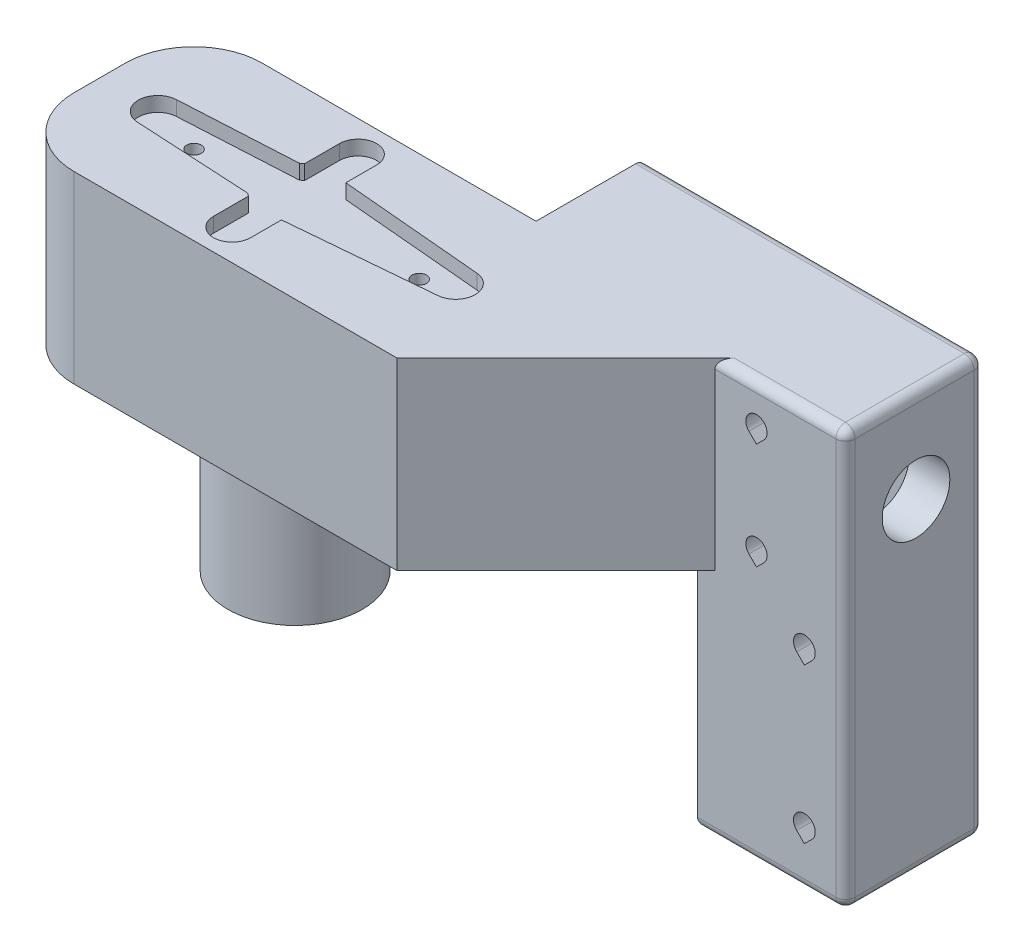
from build123d import *

# Parameters (mm, degrees)
RESSALTO_EXTRUS_O1_DEPTH = 1.4
ESBO_O2_R                = 3.45
RESSALTO_EXTRUS_O2_DEPTH = 2.4
FURO1_D                  = 1.2
PADR_O_LINEAR1_COUNT     = 6
PADR_O_LINEAR1_PITCH     = 2
RESSALTO_EXTRUS_O3_DEPTH = 1.4
FURO2_D                  = 1.2
PADR_O_LINEAR2_COUNT     = 7
PADR_O_LINEAR2_PITCH     = 2
RESSALTO_EXTRUS_O4_DEPTH = 1.4
FURO3_D                  = 1.2
PADR_O_LINEAR3_COUNT     = 2
PADR_O_LINEAR3_PITCH     = 2
PADR_OCIRCULAR1_COUNT    = 2
PADR_OCIRCULAR1_COPY_1_D = 1.2
FURO4_D                  = 4.95
FURO4_DEPTH              = 2
FURO5_D                  = 4.6
FURO5_DEPTH              = 1
FURO6_D                  = 2.1
RESSALTO_EXTRUS_O5_START = -2
RESSALTO_EXTRUS_O5_DEPTH = 2
PADR_OCIRCULAR2_COUNT    = 60
BOSS_EXTRUDE1_DEPTH      = 4
FILLET1_R                = 7
BOSS_EXTRUDE2_START      = -2.5
SKETCH2_R                = 1.7
BOSS_EXTRUDE2_DEPTH      = 2.5
SCALE1_SCALE             = 1.01
SKETCH3_R                = 6.95
BOSS_EXTRUDE3_DEPTH      = 30
SKETCH4_R                = 0.75
CUT_EXTRUDE1_DEPTH       = 2.525
BOSS_EXTRUDE4_OUTLINE_R  = 1.717
BOSS_EXTRUDE4_DEPTH      = 2.525
SKETCH6_R                = 0.75
BOSS_EXTRUDE5_DEPTH      = 15
SKETCH7_W                = 3
SKETCH7_H                = 19.04
BOSS_EXTRUDE6_DEPTH      = 30
SKETCH8_W                = 35
SKETCH8_H                = 19.04
BOSS_EXTRUDE7_DEPTH      = 11.29409
SKETCH9_R                = 3.498615
CUT_EXTRUDE2_DEPTH       = 35
SKETCH10_W               = 9.58817
SKETCH10_H               = 16.58818
CUT_EXTRUDE3_DEPTH       = 30.79409
CHAMFER2_SIZE            = 16.5
CUT_EXTRUDE4_DEPTH       = 3
BOSS_EXTRUDE8_DEPTH      = 24
BOSS_EXTRUDE9_DEPTH      = 11.29409
SKETCH17_W               = 13.8
SKETCH17_H               = 2
BOSS_EXTRUDE10_DEPTH     = 22
FILLET2_R                = 1
CUT_EXTRUDE8_DEPTH       = 10


# Read off the part's stored shape, not the designer's step: Boss-Extrude4
with BuildPart() as part:
    # Esboço1 → Ressalto-extrusão1 (new body)
    with BuildSketch(Plane(origin=(0, 0, 0), x_dir=(1, 0, 0), z_dir=(0, 1, 0))):
        with BuildLine():
            Line((-14.159121967, 1.99702088), (-2.209072203, 2.65))
            ThreePointArc((-2.209072203, 2.65), (3.45, 0), (-2.209072203, -2.65))
            Line((-2.209072203, -2.65), (-14.159121967, -1.99702088))
            ThreePointArc((-14.159121967, -1.99702088), (-16.05, 0), (-14.159121967, 1.99702088))
        make_face()
    extrude(amount=-RESSALTO_EXTRUS_O1_DEPTH)

    # Esboço2 → Ressalto-extrusão2 (add)
    with BuildSketch(Plane.XZ.offset(1.4)):
        with Locations(Location((0, 0, 0), (0, 0, 90))):
            Circle(ESBO_O2_R)
    extrude(amount=RESSALTO_EXTRUS_O2_DEPTH)

    # Furo1 (through all)
    with Locations(Plane(origin=(0, 0, 0), x_dir=(1, 0, 0), z_dir=(0, 1, 0))):
        with Locations((-14.45, 0)):
            furo1 = Hole(FURO1_D / 2)

    # Padrão linear1: Furo1 ×6
    with Locations(*[(i * PADR_O_LINEAR1_PITCH, 0, 0) for i in range(1, PADR_O_LINEAR1_COUNT)]):
        add(furo1, mode=Mode.SUBTRACT)

    # Esboço12 → Ressalto-extrusão3 (add)
    with BuildSketch(Plane(origin=(0, 0, 0), x_dir=(1, 0, 0), z_dir=(0, 1, 0))):
        with BuildLine():
            Line((0.304103343, 3.436571134), (16.626291793, 1.99221515))
            ThreePointArc((16.626291793, 1.99221515), (18.45, 0), (16.626291793, -1.99221515))
            Line((16.626291793, -1.99221515), (0.304103343, -3.436571134))
            ThreePointArc((0.304103343, -3.436571134), (3.45, 0), (0.304103343, 3.436571134))
        make_face()
    extrude(amount=-RESSALTO_EXTRUS_O3_DEPTH)

    # Furo2 (through all)
    with Locations(Plane(origin=(0, 0, 0), x_dir=(1, 0, 0), z_dir=(0, 1, 0))):
        with Locations((16.85, 0)):
            furo2 = Hole(FURO2_D / 2)

    # Padrão linear2: Furo2 ×7
    with Locations(*[(-i * PADR_O_LINEAR2_PITCH, 0, 0) for i in range(1, PADR_O_LINEAR2_COUNT)]):
        add(furo2, mode=Mode.SUBTRACT)

    # Esboço16 → Ressalto-extrusão4 (add)
    with BuildSketch(Plane(origin=(0, 0, 0), x_dir=(1, 0, 0), z_dir=(0, 1, 0))):
        with BuildLine():
            Line((-1.9, -6.45), (-1.9, 6.45))
            ThreePointArc((-1.9, 6.45), (0, 8.35), (1.9, 6.45))
            Line((1.9, 6.45), (1.9, -6.45))
            ThreePointArc((1.9, -6.45), (0, -8.35), (-1.9, -6.45))
        make_face()
    extrude(amount=-RESSALTO_EXTRUS_O4_DEPTH)

    # Furo3 (through all)
    with Locations(Plane(origin=(0, 0, 0), x_dir=(1, 0, 0), z_dir=(0, 1, 0))):
        with Locations((0, -6.45)):
            furo3 = Hole(FURO3_D / 2)

    # Padrão linear3: Furo3 ×2
    with Locations(*[(0, 0, -i * PADR_O_LINEAR3_PITCH) for i in range(1, PADR_O_LINEAR3_COUNT)]):
        add(furo3, mode=Mode.SUBTRACT)

    # PadrãoCircular1: Furo3 ×2 about axis
    padr_ocircular1_axis = Axis((0, 0, 0), (0, 1, 0))
    for i in range(1, PADR_OCIRCULAR1_COUNT):
        add(furo3.rotate(padr_ocircular1_axis, i * 360 / PADR_OCIRCULAR1_COUNT), mode=Mode.SUBTRACT)

    # PadrãoCircular1 copy 1 (through all)
    with Locations(Plane(origin=(0, 0, 2), x_dir=(-1, 0, 0), z_dir=(0, 1, 0))):
        with Locations((0, -6.45)):
            Hole(PADR_OCIRCULAR1_COPY_1_D / 2)

    # Furo4
    with Locations(Plane(origin=(0, -3.8, 0), x_dir=(-1, 0, 0), z_dir=(0, -1, 0))):
        with Locations((0, 0)):
            Hole(FURO4_D / 2, depth=FURO4_DEPTH)

    # Furo5
    with Locations(Plane(origin=(0, 0, 0), x_dir=(1, 0, 0), z_dir=(0, 1, 0))):
        with Locations((0, 0)):
            Hole(FURO5_D / 2, depth=FURO5_DEPTH)

    # Furo6 (through all)
    with Locations(Plane(origin=(0, 0, 0), x_dir=(1, 0, 0), z_dir=(0, 1, 0))):
        with Locations((0, 0)):
            Hole(FURO6_D / 2)

    # Esboço11 → Ressalto-extrusão5 (add)
    with BuildSketch(Plane.XZ.offset(3.8).offset(RESSALTO_EXTRUS_O5_START)):
        with BuildLine():
            Line((-0.098056786, 2.473056786), (0, 2.375))
            Line((0, 2.375), (0.098056786, 2.473056786))
            ThreePointArc((0.098056786, 2.473056786), (0, 2.475), (-0.098056786, 2.473056786))
        make_face()
    ressalto_extrus_o5 = extrude(amount=RESSALTO_EXTRUS_O5_DEPTH)

    # PadrãoCircular2: Ressalto-extrusão5 ×60 about axis
    padr_ocircular2_axis = Axis((0, 0, 0), (0, 1, 0))
    for i in range(1, PADR_OCIRCULAR2_COUNT):
        add(ressalto_extrus_o5.rotate(padr_ocircular2_axis, i * 360 / PADR_OCIRCULAR2_COUNT))


with BuildPart() as body_2:
    # Sketch1 → Boss-Extrude1 (new body)
    with BuildSketch(Plane(origin=(0, 0, 0), x_dir=(1, 0, 0), z_dir=(0, 1, 0))):
        with BuildLine():
            Line((20, 9.624635015), (-20, 9.624635015))
            Line((-20, 9.624635015), (-5.170447338, 2.488183425))
            Line((-5.170447338, 2.488183425), (-2.209072203, 2.65))
            ThreePointArc((-2.209072203, 2.65), (-2.057742862, 2.769150468), (-1.9, 2.87967012))
            Line((-1.9, 2.87967012), (-1.9, 6.45))
            ThreePointArc((-1.9, 6.45), (0, 8.35), (1.9, 6.45))
            Line((1.9, 6.45), (1.9, 3.295349698))
            Line((1.9, 3.295349698), (6.079247067, 2.92552671))
            Line((6.079247067, 2.92552671), (20, 9.624635015))
        make_face()
        with BuildLine():
            Line((-5.170447338, 2.488183425), (-20, 9.624635015))
            Line((-20, 9.624635015), (-20, -9.624635015))
            Line((-20, -9.624635015), (-5.170447338, -2.488183425))
            Line((-5.170447338, -2.488183425), (-14.159121967, -1.99702088))
            ThreePointArc((-14.159121967, -1.99702088), (-16.05, 0), (-14.159121967, 1.99702088))
            Line((-14.159121967, 1.99702088), (-5.170447338, 2.488183425))
        make_face()
        with BuildLine():
            Line((-5.170447338, -2.488183425), (-20, -9.624635015))
            Line((-20, -9.624635015), (20, -9.624635015))
            Line((20, -9.624635015), (6.079247067, -2.92552671))
            Line((6.079247067, -2.92552671), (1.9, -3.295349698))
            Line((1.9, -3.295349698), (1.9, -6.45))
            ThreePointArc((1.9, -6.45), (0, -8.35), (-1.9, -6.45))
            Line((-1.9, -6.45), (-1.9, -2.87967012))
            ThreePointArc((-1.9, -2.87967012), (-2.057742862, -2.769150468), (-2.209072203, -2.65))
            Line((-2.209072203, -2.65), (-5.170447338, -2.488183425))
        make_face()
        with BuildLine():
            Line((20, -9.624635015), (20, 9.624635015))
            Line((20, 9.624635015), (6.079247067, 2.92552671))
            Line((6.079247067, 2.92552671), (16.626291793, 1.99221515))
            ThreePointArc((16.626291793, 1.99221515), (18.45, 0), (16.626291793, -1.99221515))
            Line((16.626291793, -1.99221515), (6.079247067, -2.92552671))
            Line((6.079247067, -2.92552671), (20, -9.624635015))
        make_face()
    extrude(amount=BOSS_EXTRUDE1_DEPTH)

    # Fillet1
    fillet1_edges = [body_2.edges().sort_by_distance(p)[0] for p in [
        (-20, 2, 9.624635015),
        (-20, 2, -9.624635015),
    ]]
    fillet(fillet1_edges, radius=FILLET1_R)

    # Sketch2 → Boss-Extrude2 (add)
    with BuildSketch(Plane.XZ.offset(BOSS_EXTRUDE2_START)):
        with BuildLine():
            Line((-1.9, 2.87967012), (-1.9, 6.45))
            ThreePointArc((-1.9, 6.45), (0, 8.35), (1.9, 6.45))
            Line((1.9, 6.45), (1.9, 3.295349698))
            Line((1.9, 3.295349698), (16.626291793, 1.99221515))
            ThreePointArc((16.626291793, 1.99221515), (18.45, 0), (16.626291793, -1.99221515))
            Line((16.626291793, -1.99221515), (1.9, -3.295349698))
            Line((1.9, -3.295349698), (1.9, -6.45))
            ThreePointArc((1.9, -6.45), (0, -8.35), (-1.9, -6.45))
            Line((-1.9, -6.45), (-1.9, -2.87967012))
            ThreePointArc((-1.9, -2.87967012), (-2.057742862, -2.769150468), (-2.209072203, -2.65))
            Line((-2.209072203, -2.65), (-14.159121967, -1.99702088))
            ThreePointArc((-14.159121967, -1.99702088), (-16.05, 0), (-14.159121967, 1.99702088))
            Line((-14.159121967, 1.99702088), (-2.209072203, 2.65))
            ThreePointArc((-2.209072203, 2.65), (-2.057742862, 2.769150468), (-1.9, 2.87967012))
        make_face()
        with Locations(Location((0, 0, 0), (0, 0, 270))):
            Circle(SKETCH2_R, mode=Mode.SUBTRACT)
    extrude(amount=BOSS_EXTRUDE2_DEPTH)


with BuildPart() as body_2_1:
    # Scale1: scaled about (0.446523548, 1.860702842, 0)
    add(body_2.part.scale(SCALE1_SCALE).moved(Location((-0.004465235, -0.018607028, 0))))

    # Sketch3 → Boss-Extrude3 (add)
    with BuildSketch(Plane.XZ.offset(0.018607028)):
        with Locations(Location((-0.004465235, 0, 0), (0, 0, 270))):
            Circle(SKETCH3_R)
    extrude(amount=BOSS_EXTRUDE3_DEPTH)

    # Sketch4 → Cut-Extrude1 (cut)
    with BuildSketch(Plane(origin=(0, 2.506392972, 0), x_dir=(1, 0, 0), z_dir=(0, 1, 0))):
        with Locations(Location((-10.454965235, 0, 0), (0, 0, 270))):
            Circle(SKETCH4_R)
        with Locations(Location((12.840034765, 0, 0), (0, 0, 270))):
            Circle(SKETCH4_R)
    extrude(amount=-CUT_EXTRUDE1_DEPTH, mode=Mode.SUBTRACT)

    # Boss-Extrude4 outline → Boss-Extrude4 (add)
    with BuildSketch(Plane(origin=(0, -0.018607028, 0), x_dir=(1, 0, 0), z_dir=(0, 1, 0))):
        with Locations((-0.004465235, 0)):
            Circle(BOSS_EXTRUDE4_OUTLINE_R)
    extrude(amount=BOSS_EXTRUDE4_DEPTH)

    # Sketch6 → Boss-Extrude5 (add)
    with BuildSketch(Plane.XZ.offset(0.018607028)):
        with BuildLine():
            Line((-13.134465235, -9.720881366), (20.195534765, -9.720881366))
            Line((20.195534765, -9.720881366), (20.195534765, 9.720881366))
            Line((20.195534765, 9.720881366), (-13.134465235, 9.720881366))
            ThreePointArc((-13.134465235, 9.720881366), (-18.133710178, 7.650126309), (-20.204465235, 2.650881366))
            Line((-20.204465235, 2.650881366), (-20.204465235, -2.650881366))
            ThreePointArc((-20.204465235, -2.650881366), (-18.133710178, -7.650126309), (-13.134465235, -9.720881366))
        make_face()
        with Locations(Location((12.840034765, 0, 0), (0, 0, 90))):
            Circle(SKETCH6_R, mode=Mode.SUBTRACT)
        with Locations(Location((-10.454965235, 0, 0), (0, 0, 90))):
            Circle(SKETCH6_R, mode=Mode.SUBTRACT)
    extrude(amount=BOSS_EXTRUDE5_DEPTH)

    # Sketch7 → Boss-Extrude6 (add)
    with BuildSketch(Plane(origin=(20.195534765, 0, 0), x_dir=(0, 0, -1), z_dir=(1, 0, 0))):
        with Locations((8.220881366, -5.498607028)):
            Rectangle(SKETCH7_W, SKETCH7_H)
    extrude(amount=BOSS_EXTRUDE6_DEPTH)

    # Sketch8 → Boss-Extrude7 (add)
    with BuildSketch(Plane(origin=(0, 0, -9.720881366), x_dir=(-1, 0, 0), z_dir=(0, 0, -1))):
        with Locations((-32.695534765, -5.498607028)):
            Rectangle(SKETCH8_W, SKETCH8_H)
    extrude(amount=BOSS_EXTRUDE7_DEPTH)

    # Sketch9 → Cut-Extrude2 (cut)
    with BuildSketch(Plane(origin=(50.195534765, 0, 0), x_dir=(0, 0, -1), z_dir=(1, 0, 0))):
        with Locations((14.016356366, -5.498607028)):
            Circle(SKETCH9_R)
    extrude(amount=-CUT_EXTRUDE2_DEPTH, mode=Mode.SUBTRACT)

    # Sketch10 → Cut-Extrude3 (cut)
    with BuildSketch(Plane.ZY.offset(-15.195534765)):
        with Locations((-14.514966366, -5.498607028)):
            Rectangle(SKETCH10_W, SKETCH10_H)
    extrude(amount=-CUT_EXTRUDE3_DEPTH, mode=Mode.SUBTRACT)

    # Chamfer2
    # the kernel refuses this chamfer: 16.5 mm, written as the material it adds along each edge
    with BuildSketch(Plane(origin=(20.195534765, 4.021392972, -6.720881366), x_dir=(-0.027495876610332974, 0, 0.9996219169113038), z_dir=(0, -1, 0))) as chamfer2_piece_1_section:
        Polygon((CHAMFER2_SIZE * 0.999621916911, -CHAMFER2_SIZE * 0.0274958766106), (-CHAMFER2_SIZE * 0.0274958766103, -CHAMFER2_SIZE * 0.999621916911), (0, 0), align=None)
    chamfer2_piece_1 = extrude(amount=19.04, mode=Mode.PRIVATE)
    chamfer2_piece_1 = split(chamfer2_piece_1, bisect_by=Plane(origin=(25.648983026, -5.498607028, 9.720881366), z_dir=(0, 0, -1)), keep=Keep.TOP, mode=Mode.PRIVATE)
    add(chamfer2_piece_1)

    # Sketch11 → Cut-Extrude4 (cut)
    with BuildSketch(Plane(origin=(0, 0, -9.720881366), x_dir=(-1, 0, 0), z_dir=(0, 0, -1))):
        with BuildLine():
            Line((-41.767442224, -0.776334488), (-40.989624765, -1.554151947))
            Line((-40.989624765, -1.554151947), (-40.211807305, -0.776334488))
            ThreePointArc((-40.211807305, -0.776334488), (-40.989624765, 1.101482972), (-41.767442224, -0.776334488))
        make_face()
        with BuildLine():
            Line((-41.767442224, -11.776514488), (-40.989624765, -12.554331947))
            Line((-40.989624765, -12.554331947), (-40.211807305, -11.776514488))
            ThreePointArc((-40.211807305, -11.776514488), (-40.989624765, -9.898697028), (-41.767442224, -11.776514488))
        make_face()
        with BuildLine():
            Line((-29.636071374, -3.312160419), (-29.989624765, -3.66571381))
            Line((-29.989624765, -3.66571381), (-30.343178155, -3.312160419))
            ThreePointArc((-30.343178155, -3.312160419), (-29.989624765, -2.458607028), (-29.636071374, -3.312160419))
        make_face()
        with BuildLine():
            Line((-29.636071374, -5.852160419), (-29.989624765, -6.20571381))
            Line((-29.989624765, -6.20571381), (-30.343178155, -5.852160419))
            ThreePointArc((-30.343178155, -5.852160419), (-29.989624765, -4.998607028), (-29.636071374, -5.852160419))
        make_face()
        with BuildLine():
            Line((-29.636071374, -8.392160419), (-29.989624765, -8.74571381))
            Line((-29.989624765, -8.74571381), (-30.343178155, -8.392160419))
            ThreePointArc((-30.343178155, -8.392160419), (-29.989624765, -7.538607028), (-29.636071374, -8.392160419))
        make_face()
    extrude(amount=-CUT_EXTRUDE4_DEPTH, mode=Mode.SUBTRACT)

    # Sketch14 → Boss-Extrude8 (add)
    with BuildSketch(Plane.XZ.offset(15.018607028)):
        Polygon((45.989624765, -9.720881366), (34.895534765, -9.720881366), (34.895534765, -6.720881366), (50.195534765, -6.720881366), (50.195534765, -9.720881366), align=None)
    extrude(amount=BOSS_EXTRUDE8_DEPTH)

    # Sketch16 → Boss-Extrude9 (add)
    with BuildSketch(Plane(origin=(0, 0, -9.720881366), x_dir=(-1, 0, 0), z_dir=(0, 0, -1))):
        Polygon((-48.695534765, -15.018607028), (-50.195534765, -15.018607028), (-50.195534765, -39.018607028), (-34.895534765, -39.018607028), (-34.895534765, -37.018607028), (-48.695534765, -37.018607028), align=None)
    extrude(amount=BOSS_EXTRUDE9_DEPTH)

    # Sketch17 → Boss-Extrude10 (add)
    with BuildSketch(Plane.XZ.offset(15.018607028)):
        with Locations((41.795534765, -20.014971366)):
            Rectangle(SKETCH17_W, SKETCH17_H)
    extrude(amount=BOSS_EXTRUDE10_DEPTH)

    # Fillet2
    fillet2_edges = [body_2_1.edges().sort_by_distance(p)[0] for p in [
        (50.195534765, -39.018607028, -13.867926366),
        (42.545534765, -39.018607028, -6.720881366),
        (34.895534765, -39.018607028, -13.867926366),
        (42.545534765, -39.018607028, -21.014971366),
        (43.445534765, 4.021392972, -6.720881366),
        (50.195534765, 4.021392972, -13.867926366),
        (50.195534765, -17.498607028, -6.720881366),
        (50.195534765, -17.498607028, -21.014971366),
        (32.695534765, 4.021392972, -21.014971366),
    ]]
    fillet(fillet2_edges, radius=FILLET2_R)

    # Sketch15 → Cut-Extrude8 (cut)
    with BuildSketch(Plane(origin=(0, 0, -9.720881366), x_dir=(-1, 0, 0), z_dir=(0, 0, -1))):
        with BuildLine():
            Line((-45.150039636, -18.064102157), (-45.945534765, -18.859597286))
            Line((-45.945534765, -18.859597286), (-46.741029893, -18.064102157))
            ThreePointArc((-46.741029893, -18.064102157), (-45.945534765, -16.143607028), (-45.150039636, -18.064102157))
        make_face()
        with BuildLine():
            Line((-46.741029893, -34.064102157), (-45.945534765, -34.859597286))
            Line((-45.945534765, -34.859597286), (-45.150039636, -34.064102157))
            ThreePointArc((-45.150039636, -34.064102157), (-45.945534765, -32.143607028), (-46.741029893, -34.064102157))
        make_face()
    extrude(amount=-CUT_EXTRUDE8_DEPTH, mode=Mode.SUBTRACT)


solid = Compound([part.part, body_2_1.part])
